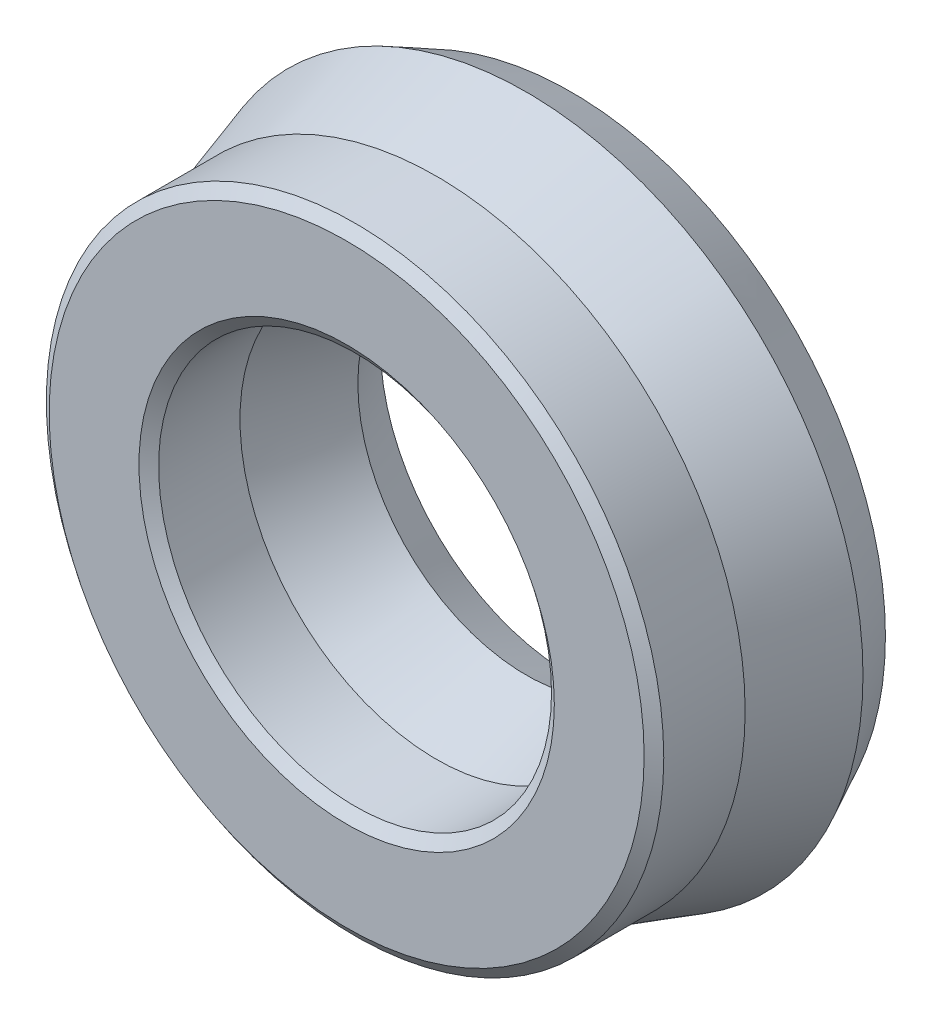
from build123d import *


with BuildPart() as part:
    # Sketch2 → Revolve1 (revolve)
    with BuildSketch(Plane(origin=(0, 0, 0), x_dir=(0, 0, -1), z_dir=(1, 0, 0))):
        with BuildLine():
            Line((0.024688303, 1.555426785), (0.024688303, 1.055426785))
            Line((0.024688303, 1.055426785), (-1.341325441, 0.598364979))
            ThreePointArc((-1.341325441, 0.598364979), (-1.436030164, 0.45504575), (-1.341325441, 0.31172652))
            Line((-1.341325441, 0.31172652), (0.024688303, -0.145335285))
            Line((0.024688303, -0.145335285), (0.024688303, -0.644573215))
            Line((0.024688303, -0.644573215), (-0.775311697, -1.044573215))
            Line((-0.775311697, -1.044573215), (-2.375311697, -0.54495425))
            Line((-2.375311697, -0.54495425), (-3.825311697, -0.54495425))
            Line((-3.825311697, -0.54495425), (-3.975311697, -0.34495425))
            Line((-3.975311697, -0.34495425), (-3.975311697, 1.25504575))
            Line((-3.975311697, 1.25504575), (-3.825311697, 1.45504575))
            Line((-3.825311697, 1.45504575), (-2.375311697, 1.45504575))
            Line((-2.375311697, 1.45504575), (-0.7754582, 1.955133643))
            Line((-0.7754582, 1.955133643), (0.024688303, 1.555426785))
        make_face()
    revolve(axis=Axis((0, 4.955426785, 17.313384256), (0, 0, -1)))


solid = part.part
